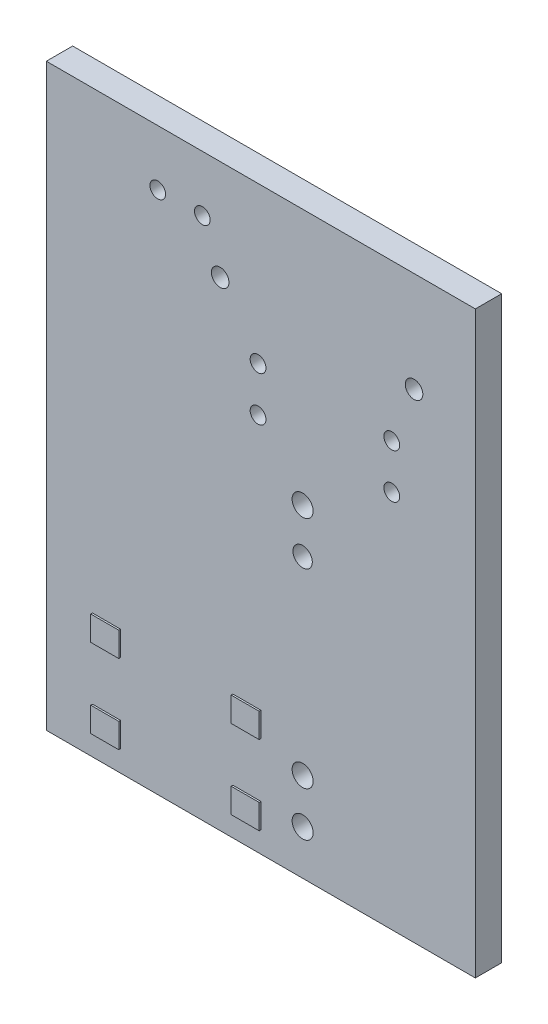
from build123d import *

# Parameters (mm, degrees)
SKETCH_1_W            = 24.4475
SKETCH_1_H            = 33.02
SKETCH_1_R            = 0.44958
SKETCH_1_R_2          = 0.55118
SKETCH_1_R_3          = 0.59944
SKETCH_1_R_4          = 0.50038
SKETCH_1_R_5          = 0.4445
EXTRUDE_1_DEPTH       = 1.5
EXTRUDE_2_OUTLINE_W   = 1.6002
EXTRUDE_2_OUTLINE_H   = 1.40208
EXTRUDE_2_OUTLINE_H_2 = 1.39954
EXTRUDE_2_DEPTH       = 0.1


# Read off the part's stored shape, not the designer's step: Бобышка-Вытянуть2
with BuildPart() as part:
    # Эскиз1 → Бобышка-Вытянуть1 (new body)
    with BuildSketch(Plane.XY):
        with Locations((12.22375, 16.51)):
            Rectangle(SKETCH_1_W, SKETCH_1_H)
        with Locations((19.685, 21.59)):
            Circle(SKETCH_1_R, mode=Mode.SUBTRACT)
        with Locations((19.685, 24.13)):
            Circle(SKETCH_1_R, mode=Mode.SUBTRACT)
        with Locations((12.065, 24.13)):
            Circle(SKETCH_1_R, mode=Mode.SUBTRACT)
        with Locations((12.065, 21.59)):
            Circle(SKETCH_1_R, mode=Mode.SUBTRACT)
        with Locations((14.605, 15.875)):
            Circle(SKETCH_1_R_2, mode=Mode.SUBTRACT)
        with Locations((14.605, 18.415)):
            Circle(SKETCH_1_R_3, mode=Mode.SUBTRACT)
        with Locations((14.605, 2.54)):
            Circle(SKETCH_1_R_3, mode=Mode.SUBTRACT)
        with Locations((14.605, 5.08)):
            Circle(SKETCH_1_R_3, mode=Mode.SUBTRACT)
        with Locations((9.906, 27.305)):
            Circle(SKETCH_1_R_4, mode=Mode.SUBTRACT)
        with Locations((20.955, 27.305)):
            Circle(SKETCH_1_R_4, mode=Mode.SUBTRACT)
        with Locations((8.89, 29.845)):
            Circle(SKETCH_1_R_5, mode=Mode.SUBTRACT)
        with Locations((6.35, 29.845)):
            Circle(SKETCH_1_R_5, mode=Mode.SUBTRACT)
    extrude(amount=EXTRUDE_1_DEPTH)

    # Бобышка-Вытянуть2 outline → Бобышка-Вытянуть2 (add)
    with BuildSketch(Plane.XY.offset(1.5)):
        with Locations((3.429, 1.905)):
            Rectangle(EXTRUDE_2_OUTLINE_W, EXTRUDE_2_OUTLINE_H)
        with Locations((3.429, 6.40461)):
            Rectangle(EXTRUDE_2_OUTLINE_W, EXTRUDE_2_OUTLINE_H_2)
        with Locations((11.43, 1.905)):
            Rectangle(EXTRUDE_2_OUTLINE_W, EXTRUDE_2_OUTLINE_H)
        with Locations((11.43, 6.40461)):
            Rectangle(EXTRUDE_2_OUTLINE_W, EXTRUDE_2_OUTLINE_H_2)
    extrude(amount=EXTRUDE_2_DEPTH)


solid = part.part
